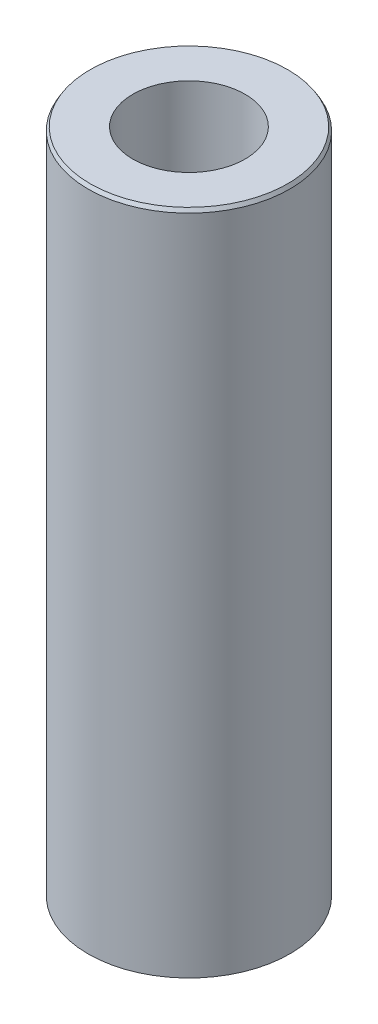
from build123d import *
from OCP.BRepFilletAPI import BRepFilletAPI_MakeChamfer

# Parameters (mm, degrees)
SKETCH1_R           = 42.5
BOSS_EXTRUDE1_DEPTH = 281.374735321
SKETCH2_R           = 23.664480177
CUT_EXTRUDE1_DEPTH  = 288.722508117
CHAMFER1_SIZE       = 1.512383748
CHAMFER1_SIZE2      = 0.873175164


with BuildPart() as part:
    # Sketch1 → Boss-Extrude1 (new body)
    with BuildSketch(Plane(origin=(0, 0, 0), x_dir=(1, 0, 0), z_dir=(0, 1, 0))):
        Circle(SKETCH1_R)
    extrude(amount=BOSS_EXTRUDE1_DEPTH)

    # Sketch2 → Cut-Extrude1 (cut, through all)
    with BuildSketch(Plane(origin=(0, 0, 0), x_dir=(1, 0, 0), z_dir=(0, 1, 0))):
        Circle(SKETCH2_R)
    extrude(amount=CUT_EXTRUDE1_DEPTH, mode=Mode.SUBTRACT)

    # Chamfer1: one chamfer whose edges measure the first distance from different faces: ONE call of the kernel's chamfer builder (chamfer() names one face for all edges)
    chamfer1_edges_1 = [part.edges().sort_by_distance(p)[0] for p in [
        (-42.5, 281.374735321, 0),
    ]]
    chamfer1_side_1 = [part.faces().sort_by_distance(p)[0] for p in [
        (-42.5, 140.687367661, 0),
    ]]
    chamfer1_edges_2 = [part.edges().sort_by_distance(p)[0] for p in [
        (-42.5, 0, 0),
    ]]
    chamfer1_side_2 = [part.faces().sort_by_distance(p)[0] for p in [
        (-41.297918472, 0, 0),
    ]]
    chamfer1 = BRepFilletAPI_MakeChamfer(part.part.solid().wrapped)
    for e in chamfer1_edges_1:
        chamfer1.Add(CHAMFER1_SIZE, CHAMFER1_SIZE2, e.wrapped, chamfer1_side_1[0].wrapped)  # the first distance lies on this face
    for e in chamfer1_edges_2:
        chamfer1.Add(CHAMFER1_SIZE, CHAMFER1_SIZE2, e.wrapped, chamfer1_side_2[0].wrapped)  # the first distance lies on this face
    add(Compound.cast(chamfer1.Shape()), mode=Mode.REPLACE)


solid = part.part
